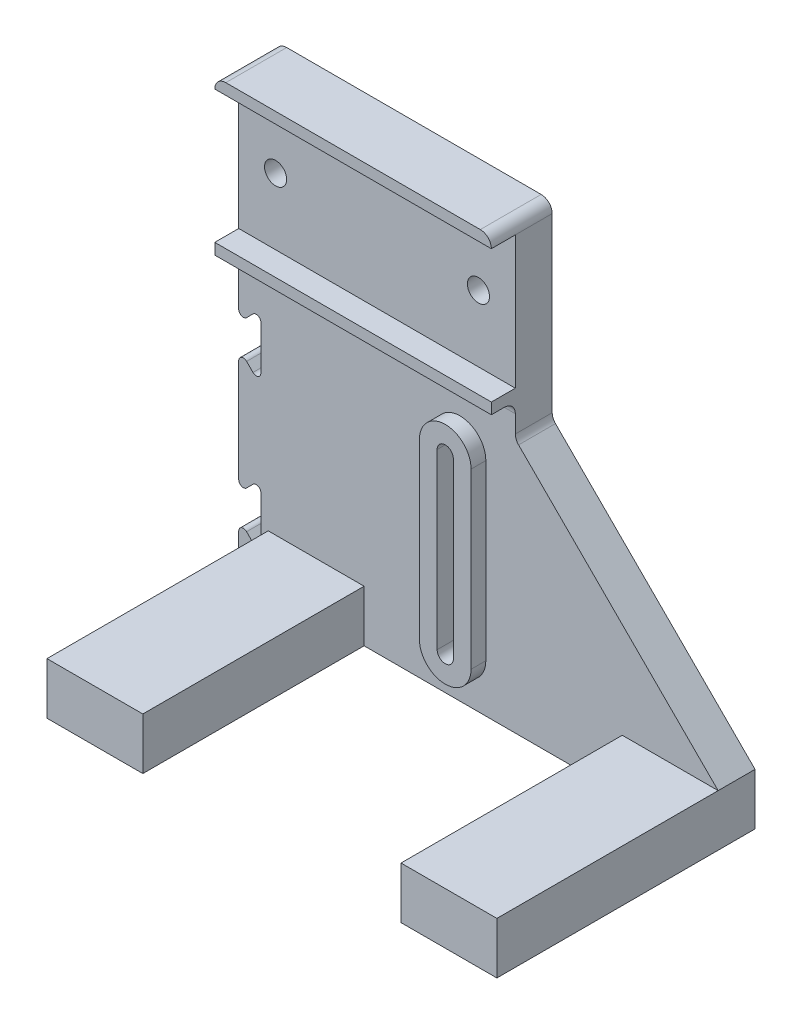
from build123d import *

# Parameters (mm, degrees)
BOSS_EXTRUDE1_DEPTH = 10
SKETCH3_W           = 75
SKETCH3_H           = 3
BOSS_EXTRUDE2_DEPTH = 6.5
SKETCH4_R           = 3
CUT_EXTRUDE2_DEPTH  = 10
SKETCH5_W           = 26
SKETCH5_H           = 14
BOSS_EXTRUDE3_DEPTH = 60
BOSS_EXTRUDE5_DEPTH = 4
CUT_EXTRUDE3_DEPTH  = 186.569394028
FILLET2_START       = -10
FILLET2_DEPTH       = 10
FILLET2_2_DEPTH     = 75
FILLET2_START_2     = -11
FILLET2_3_DEPTH     = 18
CUT_EXTRUDE4_DEPTH  = 187.815416923
FILLET3_R           = 1.25


with BuildPart() as part:
    # Sketch2 → Boss-Extrude1 (new body)
    with BuildSketch(Plane.XY):
        Polygon((0, 0), (130, 0), (130, 14), (75, 69), (75, 120), (0, 120), align=None)
    extrude(amount=-BOSS_EXTRUDE1_DEPTH)

    # Sketch3 → Boss-Extrude2 (add)
    with BuildSketch(Plane.XY):
        with Locations((37.5, 118.5)):
            Rectangle(SKETCH3_W, SKETCH3_H)
        with Locations((37.5, 79.5)):
            Rectangle(SKETCH3_W, SKETCH3_H)
    extrude(amount=BOSS_EXTRUDE2_DEPTH)

    # Sketch4 → Cut-Extrude2 (cut)
    with BuildSketch(Plane.XY):
        with Locations((10, 99)):
            Circle(SKETCH4_R)
        with Locations((65, 99)):
            Circle(SKETCH4_R)
    extrude(amount=-CUT_EXTRUDE2_DEPTH, mode=Mode.SUBTRACT)

    # Sketch5 → Boss-Extrude3 (add)
    with BuildSketch(Plane.XY):
        with Locations((117, 7)):
            Rectangle(SKETCH5_W, SKETCH5_H)
        with Locations((21, 7)):
            Rectangle(SKETCH5_W, SKETCH5_H)
    extrude(amount=BOSS_EXTRUDE3_DEPTH)

    # Sketch7 → Boss-Extrude5 (add)
    with BuildSketch(Plane.XY):
        with BuildLine():
            Line((53, 13), (53, 60))
            ThreePointArc((53, 60), (60, 67), (67, 60))
            Line((67, 60), (67, 13))
            ThreePointArc((67, 13), (60, 6), (53, 13))
        make_face()
    extrude(amount=BOSS_EXTRUDE5_DEPTH)

    # Sketch8 → Cut-Extrude3 (cut, through all)
    with BuildSketch(Plane.XY.offset(4)):
        with BuildLine():
            Line((62.2, 13), (62.2, 60))
            ThreePointArc((62.2, 60), (60, 62.2), (57.8, 60))
            Line((57.8, 60), (57.8, 13))
            ThreePointArc((57.8, 13), (60, 10.8), (62.2, 13))
        make_face()
    extrude(amount=-CUT_EXTRUDE3_DEPTH, mode=Mode.SUBTRACT)

    # Fillet2: read off the stored shape, not the designer's step
    # Fillet2 outline → Fillet2 (add)
    with BuildSketch(Plane.XY.offset(FILLET2_START)):
        with BuildLine():
            ThreePointArc((75.878679656, 68.121320344), (75.228361402, 69.09459039), (75, 70.242640687))
            Line((75, 70.242640687), (75, 69))
            Line((75, 69), (75.878679656, 68.121320344))
        make_face()
    extrude(amount=FILLET2_DEPTH)

    # Fillet2 2 outline → Fillet2 2 (add)
    with BuildSketch(Plane.YZ):
        with BuildLine():
            ThreePointArc((78, 3), (77.121320344, 0.878679656), (75, 0))
            Line((75, 0), (78, 0))
            Line((78, 0), (78, 3))
        make_face()
    extrude(amount=FILLET2_2_DEPTH)

    # Fillet2 3 outline → Fillet2 3 (cut)
    with BuildSketch(Plane.XY.offset(FILLET2_START_2)):
        with BuildLine():
            ThreePointArc((0, 117), (0.878679656, 119.121320344), (3, 120))
            Line((3, 120), (0, 120))
            Line((0, 120), (0, 117))
        make_face()
        with BuildLine():
            ThreePointArc((72, 120), (74.121320344, 119.121320344), (75, 117))
            Line((75, 117), (75, 120))
            Line((75, 120), (72, 120))
        make_face()
    extrude(amount=FILLET2_3_DEPTH, mode=Mode.SUBTRACT)

    # Sketch6 → Cut-Extrude4 (cut, through all)
    with BuildSketch(Plane.XY):
        Polygon((0, 13), (6, 7), (6, 25), (0, 19), align=None)
        Polygon((6, 47), (0, 53), (0, 59), (6, 65), align=None)
    extrude(amount=-CUT_EXTRUDE4_DEPTH, mode=Mode.SUBTRACT)

    # Fillet3
    fillet3_edges = [part.edges().sort_by_distance(p)[0] for p in [
        (0, 13, -5),
        (0, 19, -5),
        (6, 25, -5),
        (6, 7, -5),
        (6, 65, -5),
        (6, 47, -5),
        (0, 53, -5),
        (0, 59, -5),
    ]]
    fillet(fillet3_edges, radius=FILLET3_R)


solid = part.part
